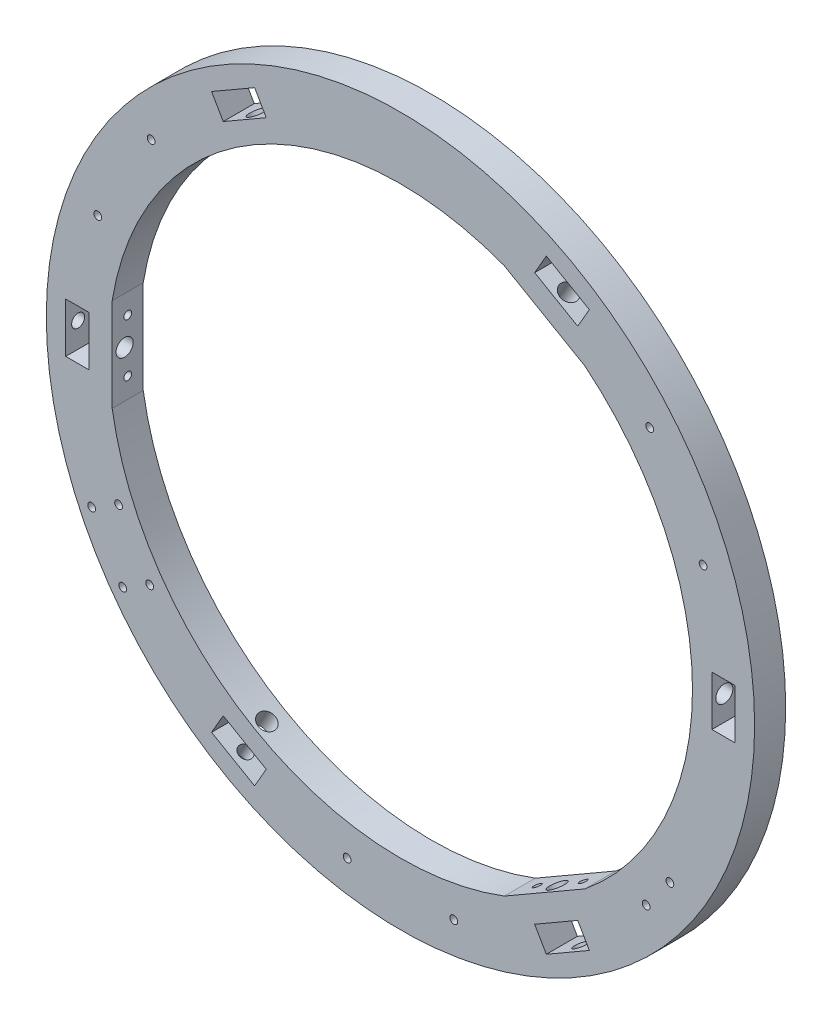
from build123d import *

# Parameters (mm, degrees)
ESQUISSE1_R                           = 114
BOSS_EXTRU_1_DEPTH                    = 10
ESQUISSE2_R                           = 1.25
ENL_V_MAT_EXTRU_1_DEPTH               = 7.45
R_P_TITION_CIRCULAIRE1_COUNT          = 3
ENL_V_MAT_EXTRU_2_REACH               = 163.53
ESQUISSE3_W                           = 7.5
ESQUISSE3_H                           = 16
ENL_V_MAT_EXTRU_3_REACH               = 244.897
ENL_V_MAT_EXTRU_3_END_RADIUS          = 94
ESQUISSE4_R                           = 2.75
ESQUISSE5_R                           = 2.1
ENL_V_MAT_EXTRU_4_DEPTH               = 5
R_P_TITION_START                      = -107.75
R_P_TITION_CIRCULAIRE2_OUTLINE_W      = 16
R_P_TITION_CIRCULAIRE2_OUTLINE_H      = 10
R_P_TITION_CIRCULAIRE2_DEPTH          = 7.5
R_P_TITION_START_2                    = -100.25
R_P_TITION_CIRCULAIRE2_2_OUTLINE_R    = 2.75
R_P_TITION_CIRCULAIRE2_2_DEPTH        = 7.454525972
R_P_TITION_START_3                    = -112.75
R_P_TITION_CIRCULAIRE2_3_OUTLINE_R    = 2.1
R_P_TITION_CIRCULAIRE2_3_DEPTH        = 5
R_P_TITION_CIRCULAIRE2_4_OUTLINE_W    = 16
R_P_TITION_CIRCULAIRE2_4_OUTLINE_H    = 10
R_P_TITION_CIRCULAIRE2_4_DEPTH        = 7.5
R_P_TITION_START_4                    = 100.25
R_P_TITION_CIRCULAIRE2_5_OUTLINE_W    = 16
R_P_TITION_CIRCULAIRE2_5_OUTLINE_H    = 10
R_P_TITION_CIRCULAIRE2_5_DEPTH        = 7.5
R_P_TITION_CIRCULAIRE2_6_OUTLINE_R    = 2.1
R_P_TITION_CIRCULAIRE2_6_DEPTH        = 225.5
R_P_TITION_CIRCULAIRE2_7_OUTLINE_R    = 2.75
R_P_TITION_CIRCULAIRE2_7_OUTLINE_R_2  = 2.1
R_P_TITION_CIRCULAIRE2_7_DEPTH        = 200.5
R_P_TITION_CIRCULAIRE2_8_OUTLINE_W    = 16
R_P_TITION_CIRCULAIRE2_8_OUTLINE_H    = 10
R_P_TITION_CIRCULAIRE2_8_DEPTH        = 7.5
R_P_TITION_CIRCULAIRE2_9_OUTLINE_W    = 16
R_P_TITION_CIRCULAIRE2_9_OUTLINE_H    = 10
R_P_TITION_CIRCULAIRE2_9_DEPTH        = 7.5
R_P_TITION_CIRCULAIRE2_10_OUTLINE_R   = 2.1
R_P_TITION_CIRCULAIRE2_10_DEPTH       = 225.5
R_P_TITION_CIRCULAIRE2_11_OUTLINE_R   = 2.75
R_P_TITION_CIRCULAIRE2_11_OUTLINE_R_2 = 2.1
R_P_TITION_CIRCULAIRE2_11_DEPTH       = 200.5
SERVO_SUPPORT_HOLES_REACH             = 163.53
ESQUISSE6_R                           = 1.25
ENL_V_MAT_EXTRU_6_REACH               = 163.53
ESQUISSE7_R                           = 1.25
R_P_TITION_CIRCULAIRE3_COUNT          = 3
LIMIT_SWITCH_SUPPORT_HOLES_REACH      = 163.53
ESQUISSE8_R                           = 1.25


# Read off the part's stored shape, not the designer's step: Répétition circulaire2
with BuildPart() as part:
    # Esquisse1 → Boss.-Extru.1 (new body)
    with BuildSketch(Plane.XY):
        Circle(ESQUISSE1_R)
        with BuildLine():
            Line((59.388118071, 72.863237864), (33.407355957, 87.863237864))
            ThreePointArc((33.407355957, 87.863237864), (-47, 81.406387956), (-92.795474028, 15))
            Line((-92.795474028, 15), (-92.795474028, -15))
            ThreePointArc((-92.795474028, -15), (-47, -81.406387956), (33.407355957, -87.863237864))
            Line((33.407355957, -87.863237864), (59.388118071, -72.863237864))
            ThreePointArc((59.388118071, -72.863237864), (94, 0), (59.388118071, 72.863237864))
        make_face(mode=Mode.SUBTRACT)
    extrude(amount=BOSS_EXTRU_1_DEPTH)

    # Esquisse2 → Enlèv. mat.-Extru.1 (cut)
    with BuildSketch(Plane(origin=(46.397737014, -80.363237864, 0), x_dir=(0.8660254037844383, 0.5000000000000008, 0), z_dir=(-0.5000000000000007, 0.8660254037844382, 0))):
        with Locations(Location((-8.5, -5, 0), (0, 0, 180))):
            Circle(ESQUISSE2_R)
        with Locations(Location((8.5, -5, 0), (0, 0, 180))):
            Circle(ESQUISSE2_R)
    enl_v_mat_extru_1 = extrude(amount=-ENL_V_MAT_EXTRU_1_DEPTH, mode=Mode.SUBTRACT)

    # Répétition circulaire1: Enlèv. mat.-Extru.1 ×3 about axis
    r_p_tition_circulaire1_axis = Axis((0, 0, 0), (0, 0, 1))
    for i in range(1, R_P_TITION_CIRCULAIRE1_COUNT):
        add(enl_v_mat_extru_1.rotate(r_p_tition_circulaire1_axis, i * 360 / R_P_TITION_CIRCULAIRE1_COUNT), mode=Mode.SUBTRACT)

    # Esquisse3 → Enlèv. mat.-Extru.2 (cut, up to next)
    with BuildSketch(Plane(origin=(0, 0, 0), x_dir=(-1, 0, 0), z_dir=(0, 0, -1)), mode=Mode.PRIVATE) as enl_v_mat_extru_2_sk1:
        with Locations((-104, 0)):
            Rectangle(ESQUISSE3_W, ESQUISSE3_H)
    enl_v_mat_extru_2_tool1 = extrude(enl_v_mat_extru_2_sk1.sketch, amount=-ENL_V_MAT_EXTRU_2_REACH, mode=Mode.PRIVATE) & part.part
    add(enl_v_mat_extru_2_tool1.solids().sort_by_distance((104, 0, 0))[0], mode=Mode.SUBTRACT)

    # Enlèv. mat.-Extru.3: up to this cylinder (the profile starts outside it)
    enl_v_mat_extru_3_end = Plane(origin=(0, 0, 6), z_dir=(0, 0, -1)) * Cylinder(ENL_V_MAT_EXTRU_3_END_RADIUS, 678.794, mode=Mode.PRIVATE)
    # Esquisse4 → Enlèv. mat.-Extru.3 (cut, up to the surface)
    with BuildSketch(Plane(origin=(100.25, 0, 0), x_dir=(0, 0, -1), z_dir=(1, 0, 0)), mode=Mode.PRIVATE) as enl_v_mat_extru_3_sk1:
        with Locations((-6, 0)):
            Circle(ESQUISSE4_R)
    enl_v_mat_extru_3_tool1 = extrude(enl_v_mat_extru_3_sk1.sketch, amount=-ENL_V_MAT_EXTRU_3_REACH, mode=Mode.PRIVATE) - enl_v_mat_extru_3_end
    add(enl_v_mat_extru_3_tool1.solids().sort_by_distance((100.25, 0, 6))[0], mode=Mode.SUBTRACT)

    # Esquisse5 → Enlèv. mat.-Extru.4 (cut)
    with BuildSketch(Plane.ZY.offset(-107.75)):
        with Locations((6, 0)):
            Circle(ESQUISSE5_R)
    extrude(amount=-ENL_V_MAT_EXTRU_4_DEPTH, mode=Mode.SUBTRACT)

    # Répétition circulaire2 outline → Répétition circulaire2 (cut)
    with BuildSketch(Plane.YZ.offset(R_P_TITION_START)):
        with Locations((0, 5)):
            Rectangle(R_P_TITION_CIRCULAIRE2_OUTLINE_W, R_P_TITION_CIRCULAIRE2_OUTLINE_H)
    extrude(amount=R_P_TITION_CIRCULAIRE2_DEPTH, mode=Mode.SUBTRACT)

    # R_p_tition circulaire2 2 outline → R_p_tition circulaire2 2 (cut)
    with BuildSketch(Plane.YZ.offset(R_P_TITION_START_2)):
        with Locations((0, 6)):
            Circle(R_P_TITION_CIRCULAIRE2_2_OUTLINE_R)
    extrude(amount=R_P_TITION_CIRCULAIRE2_2_DEPTH, mode=Mode.SUBTRACT)

    # R_p_tition circulaire2 3 outline → R_p_tition circulaire2 3 (cut)
    with BuildSketch(Plane.YZ.offset(R_P_TITION_START_3)):
        with Locations((0, 6)):
            Circle(R_P_TITION_CIRCULAIRE2_3_OUTLINE_R)
    extrude(amount=R_P_TITION_CIRCULAIRE2_3_DEPTH, mode=Mode.SUBTRACT)

    # R_p_tition circulaire2 4 outline → R_p_tition circulaire2 4 (cut)
    with BuildSketch(Plane(origin=(0, 0, 0), x_dir=(0.8660254037844398, -0.499999999999998, 0), z_dir=(0.49999999999999795, 0.8660254037844399, 0)).offset(R_P_TITION_START)):
        with Locations((0, -5)):
            Rectangle(R_P_TITION_CIRCULAIRE2_4_OUTLINE_W, R_P_TITION_CIRCULAIRE2_4_OUTLINE_H)
    extrude(amount=R_P_TITION_CIRCULAIRE2_4_DEPTH, mode=Mode.SUBTRACT)

    # R_p_tition circulaire2 5 outline → R_p_tition circulaire2 5 (cut)
    with BuildSketch(Plane(origin=(0, 0, 0), x_dir=(0.8660254037844398, -0.499999999999998, 0), z_dir=(0.49999999999999795, 0.8660254037844399, 0)).offset(R_P_TITION_START_4)):
        with Locations((0, -5)):
            Rectangle(R_P_TITION_CIRCULAIRE2_5_OUTLINE_W, R_P_TITION_CIRCULAIRE2_5_OUTLINE_H)
    extrude(amount=R_P_TITION_CIRCULAIRE2_5_DEPTH, mode=Mode.SUBTRACT)

    # R_p_tition circulaire2 6 outline → R_p_tition circulaire2 6 (cut)
    with BuildSketch(Plane(origin=(0, 0, 0), x_dir=(0.8660254037844398, -0.499999999999998, 0), z_dir=(0.49999999999999795, 0.8660254037844399, 0)).offset(R_P_TITION_START_3)):
        with Locations((0, -6)):
            Circle(R_P_TITION_CIRCULAIRE2_6_OUTLINE_R)
    extrude(amount=R_P_TITION_CIRCULAIRE2_6_DEPTH, mode=Mode.SUBTRACT)

    # R_p_tition circulaire2 7 outline → R_p_tition circulaire2 7 (cut)
    with BuildSketch(Plane(origin=(0, 0, 0), x_dir=(0.8660254037844398, -0.499999999999998, 0), z_dir=(0.49999999999999795, 0.8660254037844399, 0)).offset(R_P_TITION_START_2)):
        with Locations((0, -6)):
            Circle(R_P_TITION_CIRCULAIRE2_7_OUTLINE_R)
        with Locations((0, -6)):
            Circle(R_P_TITION_CIRCULAIRE2_7_OUTLINE_R_2, mode=Mode.SUBTRACT)
    extrude(amount=R_P_TITION_CIRCULAIRE2_7_DEPTH, mode=Mode.SUBTRACT)

    # R_p_tition circulaire2 8 outline → R_p_tition circulaire2 8 (cut)
    with BuildSketch(Plane(origin=(0, 0, 0), x_dir=(0.8660254037844362, 0.5000000000000042, 0), z_dir=(0.5000000000000042, -0.8660254037844363, 0)).offset(R_P_TITION_START)):
        with Locations((0, 5)):
            Rectangle(R_P_TITION_CIRCULAIRE2_8_OUTLINE_W, R_P_TITION_CIRCULAIRE2_8_OUTLINE_H)
    extrude(amount=R_P_TITION_CIRCULAIRE2_8_DEPTH, mode=Mode.SUBTRACT)

    # R_p_tition circulaire2 9 outline → R_p_tition circulaire2 9 (cut)
    with BuildSketch(Plane(origin=(0, 0, 0), x_dir=(0.8660254037844362, 0.5000000000000042, 0), z_dir=(0.5000000000000042, -0.8660254037844363, 0)).offset(R_P_TITION_START_4)):
        with Locations((0, 5)):
            Rectangle(R_P_TITION_CIRCULAIRE2_9_OUTLINE_W, R_P_TITION_CIRCULAIRE2_9_OUTLINE_H)
    extrude(amount=R_P_TITION_CIRCULAIRE2_9_DEPTH, mode=Mode.SUBTRACT)

    # R_p_tition circulaire2 10 outline → R_p_tition circulaire2 10 (cut)
    with BuildSketch(Plane(origin=(0, 0, 0), x_dir=(0.8660254037844362, 0.5000000000000042, 0), z_dir=(0.5000000000000042, -0.8660254037844363, 0)).offset(R_P_TITION_START_3)):
        with Locations((0, 6)):
            Circle(R_P_TITION_CIRCULAIRE2_10_OUTLINE_R)
    extrude(amount=R_P_TITION_CIRCULAIRE2_10_DEPTH, mode=Mode.SUBTRACT)

    # R_p_tition circulaire2 11 outline → R_p_tition circulaire2 11 (cut)
    with BuildSketch(Plane(origin=(0, 0, 0), x_dir=(0.8660254037844362, 0.5000000000000042, 0), z_dir=(0.5000000000000042, -0.8660254037844363, 0)).offset(R_P_TITION_START_2)):
        with Locations((0, 6)):
            Circle(R_P_TITION_CIRCULAIRE2_11_OUTLINE_R)
        with Locations((0, 6)):
            Circle(R_P_TITION_CIRCULAIRE2_11_OUTLINE_R_2, mode=Mode.SUBTRACT)
    extrude(amount=R_P_TITION_CIRCULAIRE2_11_DEPTH, mode=Mode.SUBTRACT)

    # Esquisse6 → Servo support holes (cut, up to next)
    with BuildSketch(Plane(origin=(0, 0, 0), x_dir=(-1, 0, 0), z_dir=(0, 0, -1)), mode=Mode.PRIVATE) as servo_support_holes_sk1:
        with Locations((80.736514975, -58.160254038)):
            Circle(ESQUISSE6_R)
    servo_support_holes_tool1 = extrude(servo_support_holes_sk1.sketch, amount=-SERVO_SUPPORT_HOLES_REACH, mode=Mode.PRIVATE) & part.part
    # Esquisse6 → Servo support holes (cut, up to next)
    with BuildSketch(Plane(origin=(0, 0, 0), x_dir=(-1, 0, 0), z_dir=(0, 0, -1)), mode=Mode.PRIVATE) as servo_support_holes_sk2:
        with Locations((90.736514975, -40.839745962)):
            Circle(ESQUISSE6_R)
    servo_support_holes_tool2 = extrude(servo_support_holes_sk2.sketch, amount=-SERVO_SUPPORT_HOLES_REACH, mode=Mode.PRIVATE) & part.part
    # Esquisse6 → Servo support holes (cut, up to next)
    with BuildSketch(Plane(origin=(0, 0, 0), x_dir=(-1, 0, 0), z_dir=(0, 0, -1)), mode=Mode.PRIVATE) as servo_support_holes_sk3:
        with Locations((99.396769013, -45.839745962)):
            Circle(ESQUISSE6_R)
    servo_support_holes_tool3 = extrude(servo_support_holes_sk3.sketch, amount=-SERVO_SUPPORT_HOLES_REACH, mode=Mode.PRIVATE) & part.part
    # Esquisse6 → Servo support holes (cut, up to next)
    with BuildSketch(Plane(origin=(0, 0, 0), x_dir=(-1, 0, 0), z_dir=(0, 0, -1)), mode=Mode.PRIVATE) as servo_support_holes_sk4:
        with Locations((89.396769013, -63.160254038)):
            Circle(ESQUISSE6_R)
    servo_support_holes_tool4 = extrude(servo_support_holes_sk4.sketch, amount=-SERVO_SUPPORT_HOLES_REACH, mode=Mode.PRIVATE) & part.part
    add(servo_support_holes_tool1.solids().sort_by_distance((-80.736515, -58.160254, 0))[0], mode=Mode.SUBTRACT)
    add(servo_support_holes_tool2.solids().sort_by_distance((-90.736515, -40.839746, 0))[0], mode=Mode.SUBTRACT)
    add(servo_support_holes_tool3.solids().sort_by_distance((-99.396769, -45.839746, 0))[0], mode=Mode.SUBTRACT)
    add(servo_support_holes_tool4.solids().sort_by_distance((-89.396769, -63.160254, 0))[0], mode=Mode.SUBTRACT)

    # Esquisse7 → Enlèv. mat.-Extru.6 (cut, up to next)
    with BuildSketch(Plane(origin=(0, 0, 0), x_dir=(-1, 0, 0), z_dir=(0, 0, -1)), mode=Mode.PRIVATE) as enl_v_mat_extru_6_sk1:
        with Locations((-17.16495101, -102.57370256)):
            Circle(ESQUISSE7_R)
    enl_v_mat_extru_6_tool1 = extrude(enl_v_mat_extru_6_sk1.sketch, amount=-ENL_V_MAT_EXTRU_6_REACH, mode=Mode.PRIVATE) & part.part
    # Esquisse7 → Enlèv. mat.-Extru.6 (cut, up to next)
    with BuildSketch(Plane(origin=(0, 0, 0), x_dir=(-1, 0, 0), z_dir=(0, 0, -1)), mode=Mode.PRIVATE) as enl_v_mat_extru_6_sk2:
        with Locations((17.16495101, -102.57370256)):
            Circle(ESQUISSE7_R)
    enl_v_mat_extru_6_tool2 = extrude(enl_v_mat_extru_6_sk2.sketch, amount=-ENL_V_MAT_EXTRU_6_REACH, mode=Mode.PRIVATE) & part.part
    enl_v_mat_extru_6_1 = enl_v_mat_extru_6_tool1.solids().sort_by_distance((17.164951, -102.573703, 0))[0]
    add(enl_v_mat_extru_6_1, mode=Mode.SUBTRACT)
    enl_v_mat_extru_6_2 = enl_v_mat_extru_6_tool2.solids().sort_by_distance((-17.164951, -102.573703, 0))[0]
    add(enl_v_mat_extru_6_2, mode=Mode.SUBTRACT)
    enl_v_mat_extru_6 = enl_v_mat_extru_6_1 + enl_v_mat_extru_6_2  # Enlèv. mat.-Extru.6 as one shape, for the pattern or mirror that repeats it

    # Répétition circulaire3: Enlèv. mat.-Extru.6 ×3 about axis
    r_p_tition_circulaire3_axis = Axis((0, 0, 0), (0, 0, 1))
    for i in range(1, R_P_TITION_CIRCULAIRE3_COUNT):
        add(enl_v_mat_extru_6.rotate(r_p_tition_circulaire3_axis, i * 360 / R_P_TITION_CIRCULAIRE3_COUNT), mode=Mode.SUBTRACT)

    # Esquisse8 → limit switch support holes (cut, up to next)
    with BuildSketch(Plane(origin=(0, 0, 0), x_dir=(-1, 0, 0), z_dir=(0, 0, -1)), mode=Mode.PRIVATE) as limit_switch_support_holes_sk1:
        with Locations((-86.724125495, -57.401446472)):
            Circle(ESQUISSE8_R)
    limit_switch_support_holes_tool1 = extrude(limit_switch_support_holes_sk1.sketch, amount=-LIMIT_SWITCH_SUPPORT_HOLES_REACH, mode=Mode.PRIVATE) & part.part
    # Esquisse8 → limit switch support holes (cut, up to next)
    with BuildSketch(Plane(origin=(0, 0, 0), x_dir=(-1, 0, 0), z_dir=(0, 0, -1)), mode=Mode.PRIVATE) as limit_switch_support_holes_sk2:
        with Locations((-79.082220422, -67.542597026)):
            Circle(ESQUISSE8_R)
    limit_switch_support_holes_tool2 = extrude(limit_switch_support_holes_sk2.sketch, amount=-LIMIT_SWITCH_SUPPORT_HOLES_REACH, mode=Mode.PRIVATE) & part.part
    add(limit_switch_support_holes_tool1.solids().sort_by_distance((86.724125, -57.401446, 0))[0], mode=Mode.SUBTRACT)
    add(limit_switch_support_holes_tool2.solids().sort_by_distance((79.08222, -67.542597, 0))[0], mode=Mode.SUBTRACT)


solid = part.part
